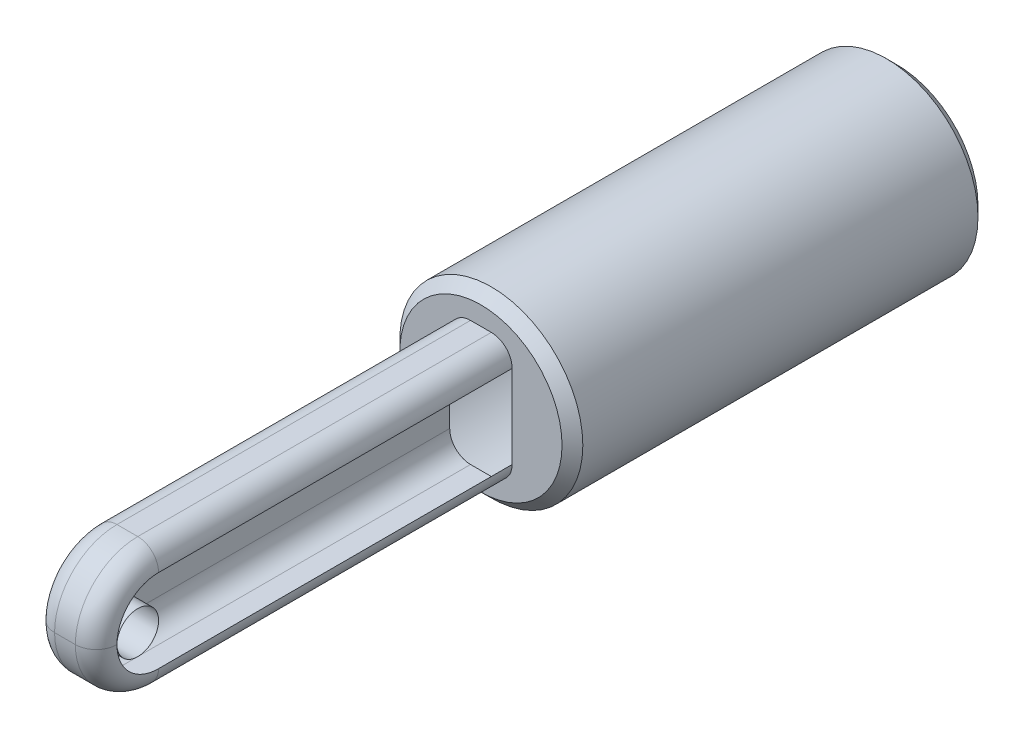
from build123d import *

# Parameters (mm, degrees)
SKETCH2_R           = 22
BOSS_EXTRUDE1_DEPTH = 100
SKETCH4_W           = 100
SKETCH4_H           = 30
BOSS_EXTRUDE2_DEPTH = 7.5
FILLET1_R           = 15
SKETCH5_R           = 5
CUT_EXTRUDE1_DEPTH  = 107.556323135
FILLET2_R           = 5
CHAMFER1_SIZE       = 2.5


with BuildPart() as part:
    # Sketch2 → Boss-Extrude1 (new body)
    with BuildSketch(Plane.XY):
        Circle(SKETCH2_R)
    extrude(amount=-BOSS_EXTRUDE1_DEPTH)

    # Sketch4 → Boss-Extrude2 (add, symmetric)
    with BuildSketch(Plane(origin=(0, 0, 0), x_dir=(0, 0, -1), z_dir=(1, 0, 0))):
        with Locations((-50, 0)):
            Rectangle(SKETCH4_W, SKETCH4_H)
    extrude(amount=BOSS_EXTRUDE2_DEPTH, both=True)

    # Fillet1
    fillet1_edges = [part.edges().sort_by_distance(p)[0] for p in [
        (0, -15, 100),
        (0, 15, 100),
    ]]
    fillet(fillet1_edges, radius=FILLET1_R - 0.0001)  # a hair under: the kernel refuses the full size

    # Sketch5 → Cut-Extrude1 (cut, through all)
    with BuildSketch(Plane(origin=(7.5, 0, 0), x_dir=(0, 0, -1), z_dir=(1, 0, 0))):
        with Locations((-90, 0)):
            Circle(SKETCH5_R)
    extrude(amount=-CUT_EXTRUDE1_DEPTH, mode=Mode.SUBTRACT)

    # Fillet2
    fillet2_edges = [part.edges().sort_by_distance(p)[0] for p in [
        (-7.5, -15, 42.50005),
        (7.5, -15, 42.50005),
        (-7.5, 10.606631007, 95.606631007),
        (-7.5, -10.606631007, 95.606631007),
        (7.5, 10.606631007, 95.606631007),
        (7.5, -10.606631007, 95.606631007),
        (-7.5, 15, 42.50005),
        (7.5, 15, 42.50005),
    ]]
    fillet(fillet2_edges, radius=FILLET2_R - 0.0001)  # a hair under: the kernel refuses the full size

    # Chamfer1
    chamfer1_edges = [part.edges().sort_by_distance(p)[0] for p in [
        (-22, 0, 0),
        (-22, 0, -100),
    ]]
    chamfer(chamfer1_edges, length=CHAMFER1_SIZE)


solid = part.part
